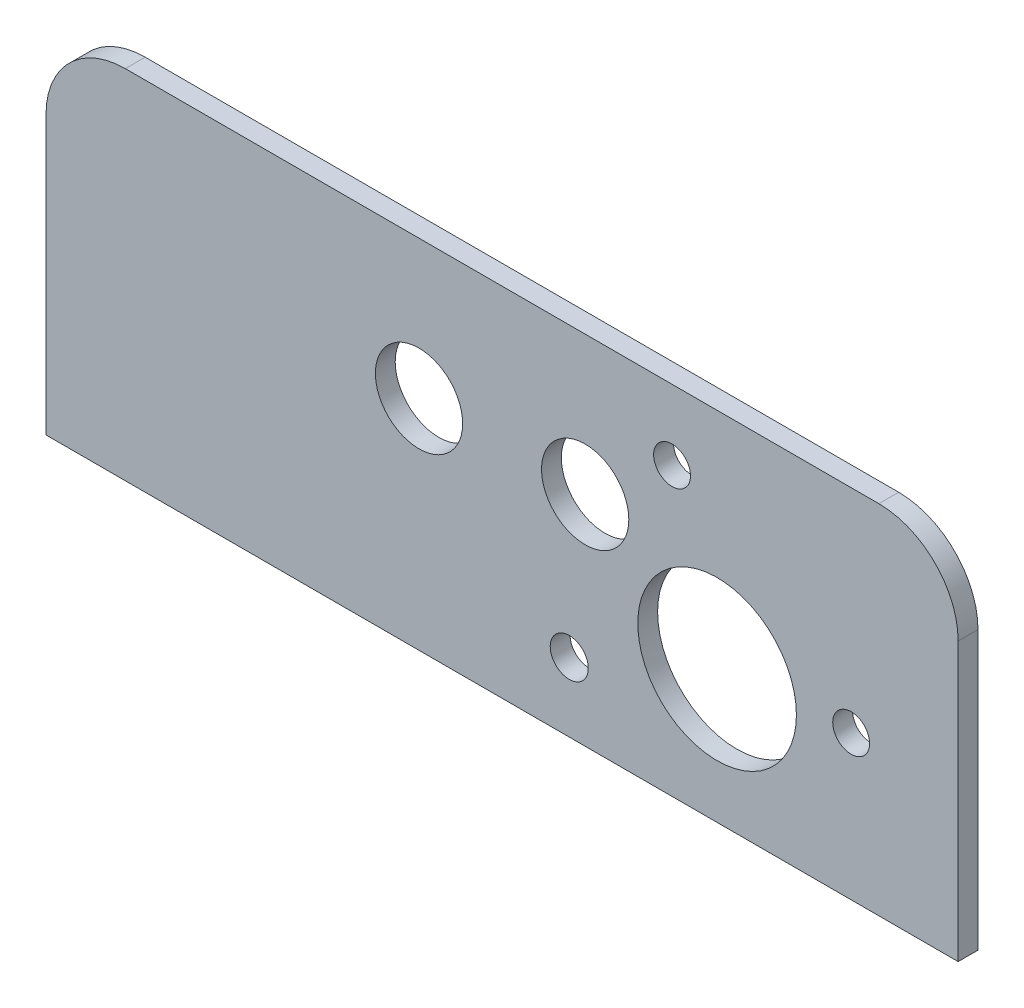
from build123d import *

# Parameters (mm, degrees)
SKETCH1_W           = 230
SKETCH1_H           = 90
BOSS_EXTRUDE1_DEPTH = 5
FILLET1_R           = 20
CUT_EXTRUDE1_REACH  = 125.592
SKETCH2_R           = 11
CUT_EXTRUDE2_REACH  = 125.592
SKETCH3_R           = 4.65
SKETCH3_R_2         = 4.8
CUT_EXTRUDE3_REACH  = 125.592
SKETCH5_R           = 20


with BuildPart() as part:
    # Sketch1 → Boss-Extrude1 (new body)
    with BuildSketch(Plane.XY):
        Rectangle(SKETCH1_W, SKETCH1_H)
    extrude(amount=BOSS_EXTRUDE1_DEPTH)

    # Fillet1
    fillet1_edges = [part.edges().sort_by_distance(p)[0] for p in [
        (115, 45, 2.5),
        (-115, 45, 2.5),
    ]]
    fillet(fillet1_edges, radius=FILLET1_R)

    # Sketch2 → Cut-Extrude1 (cut, up to next)
    with BuildSketch(Plane.XY.offset(5), mode=Mode.PRIVATE) as cut_extrude1_sk1:
        with Locations((-20.95, 10)):
            Circle(SKETCH2_R)
    cut_extrude1_tool1 = extrude(cut_extrude1_sk1.sketch, amount=-CUT_EXTRUDE1_REACH, mode=Mode.PRIVATE) & part.part
    # Sketch2 → Cut-Extrude1 (cut, up to next)
    with BuildSketch(Plane.XY.offset(5), mode=Mode.PRIVATE) as cut_extrude1_sk2:
        with Locations((20.95, 10)):
            Circle(SKETCH2_R)
    cut_extrude1_tool2 = extrude(cut_extrude1_sk2.sketch, amount=-CUT_EXTRUDE1_REACH, mode=Mode.PRIVATE) & part.part
    add(cut_extrude1_tool1.solids().sort_by_distance((-20.95, 10, 5))[0], mode=Mode.SUBTRACT)
    add(cut_extrude1_tool2.solids().sort_by_distance((20.95, 10, 5))[0], mode=Mode.SUBTRACT)

    # Sketch3 → Cut-Extrude2 (cut, up to next)
    with BuildSketch(Plane(origin=(0, 0, 0), x_dir=(-1, 0, 0), z_dir=(0, 0, -1)), mode=Mode.PRIVATE) as cut_extrude2_sk1:
        with Locations((-42.861480484, 27.315297382)):
            Circle(SKETCH3_R)
    cut_extrude2_tool1 = extrude(cut_extrude2_sk1.sketch, amount=-CUT_EXTRUDE2_REACH, mode=Mode.PRIVATE) & part.part
    # Sketch3 → Cut-Extrude2 (cut, up to next)
    with BuildSketch(Plane(origin=(0, 0, 0), x_dir=(-1, 0, 0), z_dir=(0, 0, -1)), mode=Mode.PRIVATE) as cut_extrude2_sk2:
        with Locations((-88.015918911, -8.560303387)):
            Circle(SKETCH3_R)
    cut_extrude2_tool2 = extrude(cut_extrude2_sk2.sketch, amount=-CUT_EXTRUDE2_REACH, mode=Mode.PRIVATE) & part.part
    # Sketch3 → Cut-Extrude2 (cut, up to next)
    with BuildSketch(Plane(origin=(0, 0, 0), x_dir=(-1, 0, 0), z_dir=(0, 0, -1)), mode=Mode.PRIVATE) as cut_extrude2_sk3:
        with Locations((-16.935196723, -27.604446885)):
            Circle(SKETCH3_R_2)
    cut_extrude2_tool3 = extrude(cut_extrude2_sk3.sketch, amount=-CUT_EXTRUDE2_REACH, mode=Mode.PRIVATE) & part.part
    add(cut_extrude2_tool1.solids().sort_by_distance((42.86148, 27.315297, 0))[0], mode=Mode.SUBTRACT)
    add(cut_extrude2_tool2.solids().sort_by_distance((88.015919, -8.560303, 0))[0], mode=Mode.SUBTRACT)
    add(cut_extrude2_tool3.solids().sort_by_distance((16.935197, -27.604447, 0))[0], mode=Mode.SUBTRACT)

    # Sketch5 → Cut-Extrude3 (cut, up to next)
    with BuildSketch(Plane.XY.offset(5), mode=Mode.PRIVATE) as cut_extrude3_sk1:
        with Locations((54.21355411, -11.517627108)):
            Circle(SKETCH5_R)
    cut_extrude3_tool1 = extrude(cut_extrude3_sk1.sketch, amount=-CUT_EXTRUDE3_REACH, mode=Mode.PRIVATE) & part.part
    add(cut_extrude3_tool1.solids().sort_by_distance((54.213554, -11.517627, 5))[0], mode=Mode.SUBTRACT)


solid = part.part
